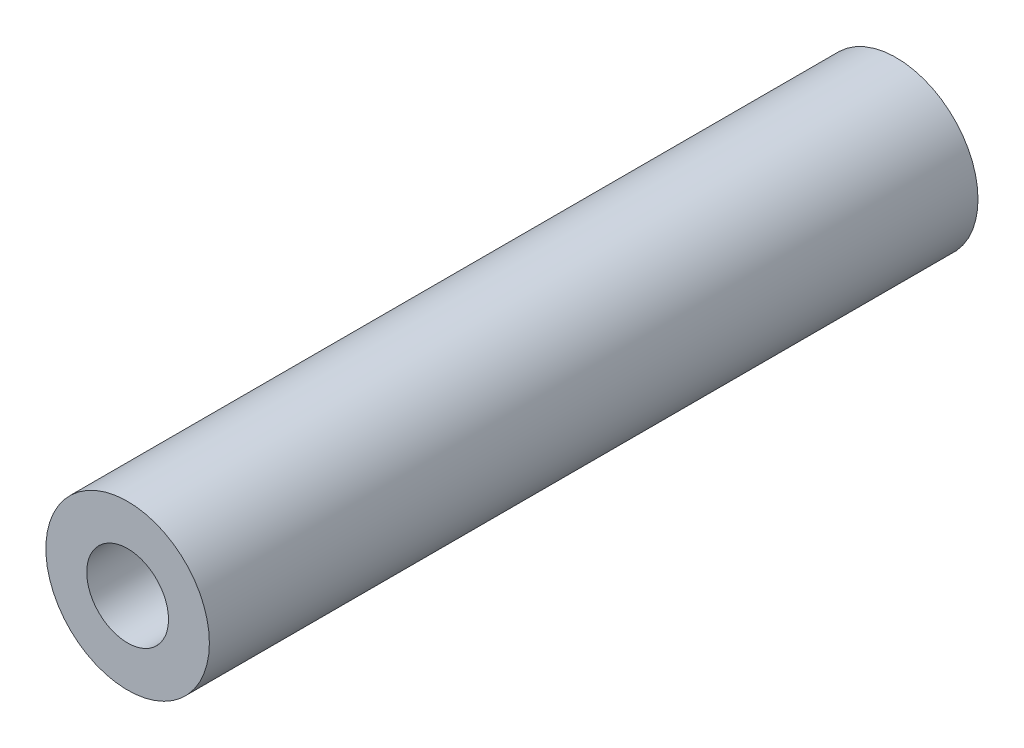
from build123d import *

# Parameters (mm, degrees)
SKETCH1_R           = 5
SKETCH1_R_2         = 2.5
BOSS_EXTRUDE1_DEPTH = 47


with BuildPart() as part:
    # Sketch1 → Boss-Extrude1 (new body)
    with BuildSketch(Plane.XY):
        Circle(SKETCH1_R)
        Circle(SKETCH1_R_2, mode=Mode.SUBTRACT)
    extrude(amount=BOSS_EXTRUDE1_DEPTH)


solid = part.part
